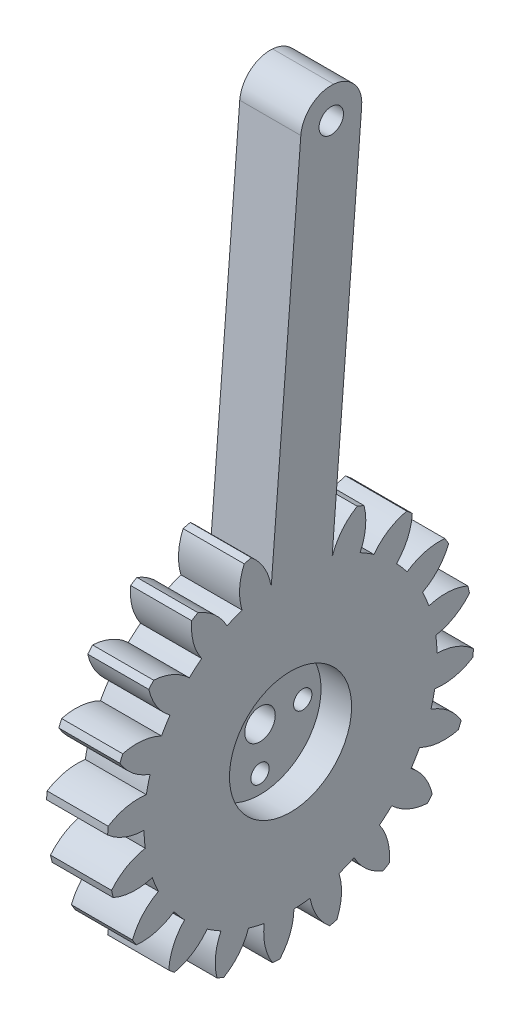
from build123d import *

# Parameters (mm, degrees)
EXTRUDE_1_DEPTH     = 10
EXTRUDE_2_DEPTH     = 10
FILLET_1_R          = 5
SKETCH_3_R          = 2.5
CUT_EXTRUDE_1_DEPTH = 10
SKETCH_4_R          = 2
CUT_EXTRUDE_2_DEPTH = 10
SKETCH_5_R          = 1.5
CUT_EXTRUDE_3_DEPTH = 10
SKETCH_6_R          = 10
CUT_EXTRUDE_4_DEPTH = 5


with BuildPart() as part:
    # 草图1 → 凸台-拉伸1 (new body)
    with BuildSketch(Plane(origin=(0, 0, 0), x_dir=(0, 0, -1), z_dir=(1, 0, 0))):
        with BuildLine():
            ThreePointArc((-7.942884534, 22.647529341), (-9.184402377, 22.17310878), (-10.397754058, 21.630689091))
            ThreePointArc((-10.397754058, 21.630689091), (-12.397305949, 24.184674774), (-15.156649968, 25.889688329))
            ThreePointArc((-15.156649968, 25.889688329), (-15.674956941, 25.579204931), (-16.186906117, 25.258346549))
            ThreePointArc((-16.186906117, 25.258346549), (-15.920443886, 22.02569307), (-14.552603542, 19.084594053))
            ThreePointArc((-14.552603542, 19.084594053), (-15.58675316, 18.249743174), (-16.573102281, 17.358925105))
            ThreePointArc((-16.573102281, 17.358925105), (-19.264014116, 19.170014316), (-22.41518439, 19.938894372))
            ThreePointArc((-22.41518439, 19.938894372), (-22.812178968, 19.48344145), (-23.199920874, 19.020085999))
            ThreePointArc((-23.199920874, 19.020085999), (-21.947555371, 16.027991201), (-19.737812321, 13.653525728))
            ThreePointArc((-19.737812321, 13.653525728), (-20.463363944, 12.539965553), (-21.126159781, 11.387948582))
            ThreePointArc((-21.126159781, 11.387948582), (-24.245026361, 12.278859291), (-27.479564388, 12.036342512))
            ThreePointArc((-27.479564388, 12.036342512), (-27.716385975, 11.480502971), (-27.941965733, 10.920006912))
            ThreePointArc((-27.941965733, 10.920006912), (-25.82628722, 8.46135788), (-22.990946508, 6.885955175))
            ThreePointArc((-22.990946508, 6.885955175), (-23.33687809, 5.602688733), (-23.611241567, 4.302240308))
            ThreePointArc((-23.611241567, 4.302240308), (-26.852766501, 4.185763967), (-29.854053162, 2.955589584))
            ThreePointArc((-29.854053162, 2.955589584), (-29.907520012, 2.353772872), (-29.948856303, 1.751001464))
            ThreePointArc((-29.948856303, 1.751001464), (-27.176962132, 0.066467896), (-23.993566664, -0.555660648))
            ThreePointArc((-23.993566664, -0.555660648), (-23.92601601, -1.883018297), (-23.785090519, -3.204601222))
            ThreePointArc((-23.785090519, -3.204601222), (-26.831970761, -4.317063099), (-29.306219208, -6.414477044))
            ThreePointArc((-29.306219208, -6.414477044), (-29.171097612, -7.003360916), (-29.024144152, -7.589404208))
            ThreePointArc((-29.024144152, -7.589404208), (-25.867366639, -8.334928429), (-22.647529341, -7.942884534))
            ThreePointArc((-22.647529341, -7.942884534), (-22.17310878, -9.184402377), (-21.630689091, -10.397754058))
            ThreePointArc((-21.630689091, -10.397754058), (-24.184674774, -12.397305949), (-25.889688329, -15.156649968))
            ThreePointArc((-25.889688329, -15.156649968), (-25.579204931, -15.674956941), (-25.258346549, -16.186906117))
            ThreePointArc((-25.258346549, -16.186906117), (-22.02569307, -15.920443886), (-19.084594053, -14.552603542))
            ThreePointArc((-19.084594053, -14.552603542), (-18.249743174, -15.58675316), (-17.358925105, -16.573102281))
            ThreePointArc((-17.358925105, -16.573102281), (-19.170014316, -19.264014116), (-19.938894372, -22.41518439))
            ThreePointArc((-19.938894372, -22.41518439), (-19.48344145, -22.812178968), (-19.020085999, -23.199920874))
            ThreePointArc((-19.020085999, -23.199920874), (-16.027991201, -21.947555371), (-13.653525728, -19.737812321))
            ThreePointArc((-13.653525728, -19.737812321), (-12.539965553, -20.463363944), (-11.387948582, -21.126159781))
            ThreePointArc((-11.387948582, -21.126159781), (-12.278859291, -24.245026361), (-12.036342512, -27.479564388))
            ThreePointArc((-12.036342512, -27.479564388), (-11.480502971, -27.716385975), (-10.920006912, -27.941965733))
            ThreePointArc((-10.920006912, -27.941965733), (-8.46135788, -25.82628722), (-6.885955175, -22.990946508))
            ThreePointArc((-6.885955175, -22.990946508), (-5.602688733, -23.33687809), (-4.302240308, -23.611241567))
            ThreePointArc((-4.302240308, -23.611241567), (-4.185763967, -26.852766501), (-2.955589584, -29.854053162))
            ThreePointArc((-2.955589584, -29.854053162), (-2.353772872, -29.907520012), (-1.751001464, -29.948856303))
            ThreePointArc((-1.751001464, -29.948856303), (-0.066467896, -27.176962132), (0.555660648, -23.993566664))
            ThreePointArc((0.555660648, -23.993566664), (1.883018297, -23.92601601), (3.204601222, -23.785090519))
            ThreePointArc((3.204601222, -23.785090519), (4.317063099, -26.831970761), (6.414477044, -29.306219208))
            ThreePointArc((6.414477044, -29.306219208), (7.003360916, -29.171097612), (7.589404208, -29.024144152))
            ThreePointArc((7.589404208, -29.024144152), (8.334928429, -25.867366639), (7.942884534, -22.647529341))
            ThreePointArc((7.942884534, -22.647529341), (9.184402377, -22.17310878), (10.397754058, -21.630689091))
            ThreePointArc((10.397754058, -21.630689091), (12.397305949, -24.184674774), (15.156649968, -25.889688329))
            ThreePointArc((15.156649968, -25.889688329), (15.674956941, -25.579204931), (16.186906117, -25.258346549))
            ThreePointArc((16.186906117, -25.258346549), (15.920443886, -22.02569307), (14.552603542, -19.084594053))
            ThreePointArc((14.552603542, -19.084594053), (15.58675316, -18.249743174), (16.573102281, -17.358925105))
            ThreePointArc((16.573102281, -17.358925105), (19.264014116, -19.170014316), (22.41518439, -19.938894372))
            ThreePointArc((22.41518439, -19.938894372), (22.812178968, -19.48344145), (23.199920874, -19.020085999))
            ThreePointArc((23.199920874, -19.020085999), (21.947555371, -16.027991201), (19.737812321, -13.653525728))
            ThreePointArc((19.737812321, -13.653525728), (20.463363944, -12.539965553), (21.126159781, -11.387948582))
            ThreePointArc((21.126159781, -11.387948582), (24.245026361, -12.278859291), (27.479564388, -12.036342512))
            ThreePointArc((27.479564388, -12.036342512), (27.716385975, -11.480502971), (27.941965733, -10.920006912))
            ThreePointArc((27.941965733, -10.920006912), (25.82628722, -8.46135788), (22.990946508, -6.885955175))
            ThreePointArc((22.990946508, -6.885955175), (23.33687809, -5.602688733), (23.611241567, -4.302240308))
            ThreePointArc((23.611241567, -4.302240308), (26.852766501, -4.185763967), (29.854053162, -2.955589584))
            ThreePointArc((29.854053162, -2.955589584), (29.907520012, -2.353772872), (29.948856303, -1.751001464))
            ThreePointArc((29.948856303, -1.751001464), (27.176962132, -0.066467896), (23.993566664, 0.555660648))
            ThreePointArc((23.993566664, 0.555660648), (23.92601601, 1.883018297), (23.785090519, 3.204601222))
            ThreePointArc((23.785090519, 3.204601222), (26.831970761, 4.317063099), (29.306219208, 6.414477044))
            ThreePointArc((29.306219208, 6.414477044), (29.171097612, 7.003360916), (29.024144152, 7.589404208))
            ThreePointArc((29.024144152, 7.589404208), (25.867366639, 8.334928429), (22.647529341, 7.942884534))
            ThreePointArc((22.647529341, 7.942884534), (22.17310878, 9.184402377), (21.630689091, 10.397754058))
            ThreePointArc((21.630689091, 10.397754058), (24.184674774, 12.397305949), (25.889688329, 15.156649968))
            ThreePointArc((25.889688329, 15.156649968), (25.579204931, 15.674956941), (25.258346549, 16.186906117))
            ThreePointArc((25.258346549, 16.186906117), (22.02569307, 15.920443886), (19.084594053, 14.552603542))
            ThreePointArc((19.084594053, 14.552603542), (18.249743174, 15.58675316), (17.358925105, 16.573102281))
            ThreePointArc((17.358925105, 16.573102281), (19.170014316, 19.264014116), (19.938894372, 22.41518439))
            ThreePointArc((19.938894372, 22.41518439), (19.48344145, 22.812178968), (19.020085999, 23.199920874))
            ThreePointArc((19.020085999, 23.199920874), (16.027991201, 21.947555371), (13.653525728, 19.737812321))
            ThreePointArc((13.653525728, 19.737812321), (12.539965553, 20.463363944), (11.387948582, 21.126159781))
            ThreePointArc((11.387948582, 21.126159781), (12.278859291, 24.245026361), (12.036342512, 27.479564388))
            ThreePointArc((12.036342512, 27.479564388), (11.480502971, 27.716385975), (10.920006912, 27.941965733))
            ThreePointArc((10.920006912, 27.941965733), (8.46135788, 25.82628722), (6.885955175, 22.990946508))
            ThreePointArc((6.885955175, 22.990946508), (5.602688733, 23.33687809), (4.302240308, 23.611241567))
            ThreePointArc((4.302240308, 23.611241567), (4.185763967, 26.852766501), (2.955589584, 29.854053162))
            ThreePointArc((2.955589584, 29.854053162), (2.353772872, 29.907520012), (1.751001464, 29.948856303))
            ThreePointArc((1.751001464, 29.948856303), (0.066467896, 27.176962132), (-0.555660648, 23.993566664))
            ThreePointArc((-0.555660648, 23.993566664), (-1.883018297, 23.92601601), (-3.204601222, 23.785090519))
            ThreePointArc((-3.204601222, 23.785090519), (-4.317063099, 26.831970761), (-6.414477044, 29.306219208))
            ThreePointArc((-6.414477044, 29.306219208), (-7.003360916, 29.171097612), (-7.589404208, 29.024144152))
            ThreePointArc((-7.589404208, 29.024144152), (-8.334928429, 25.867366639), (-7.942884534, 22.647529341))
        make_face()
    extrude(amount=EXTRUDE_1_DEPTH)

    # 草图2 → 凸台-拉伸2 (add)
    with BuildSketch(Plane(origin=(10, 0, 0), x_dir=(0, 0, -1), z_dir=(1, 0, 0))):
        Polygon((2.076731947, 90.114855515), (-4.984586669, 0.392295479), (4.984586669, -0.392295479), (12.045905284, 89.330264557), align=None)
    extrude(amount=-EXTRUDE_2_DEPTH)

    # 圆角1
    fillet_1_edges = [part.edges().sort_by_distance(p)[0] for p in [
        (5, 89.330264557, -12.045905284),
        (5, 90.114855515, -2.076731947),
    ]]
    fillet(fillet_1_edges, radius=FILLET_1_R - 0.0001)  # a hair under: the kernel refuses the full size

    # 草图3 → 切除-拉伸1 (cut)
    with BuildSketch(Plane(origin=(10, 0, 0), x_dir=(0, 0, -1), z_dir=(1, 0, 0))):
        Circle(SKETCH_3_R)
    extrude(amount=-CUT_EXTRUDE_1_DEPTH, mode=Mode.SUBTRACT)

    # 草图4 → 切除-拉伸2 (cut)
    with BuildSketch(Plane(origin=(10, 0, 0), x_dir=(0, 0, -1), z_dir=(1, 0, 0))):
        with Locations((6.669023137, 84.737973367)):
            Circle(SKETCH_4_R)
    extrude(amount=-CUT_EXTRUDE_2_DEPTH, mode=Mode.SUBTRACT)

    # 草图5 → 切除-拉伸3 (cut)
    with BuildSketch(Plane(origin=(10, 0, 0), x_dir=(0, 0, -1), z_dir=(1, 0, 0))):
        with Locations((0, 7)):
            Circle(SKETCH_5_R)
        with Locations((7, 0)):
            Circle(SKETCH_5_R)
        with Locations((0, -7)):
            Circle(SKETCH_5_R)
        with Locations((-7, 0)):
            Circle(SKETCH_5_R)
    extrude(amount=-CUT_EXTRUDE_3_DEPTH, mode=Mode.SUBTRACT)

    # 草图6 → 切除-拉伸4 (cut)
    with BuildSketch(Plane(origin=(10, 0, 0), x_dir=(0, 0, -1), z_dir=(1, 0, 0))):
        Circle(SKETCH_6_R)
    extrude(amount=-CUT_EXTRUDE_4_DEPTH, mode=Mode.SUBTRACT)


solid = part.part
